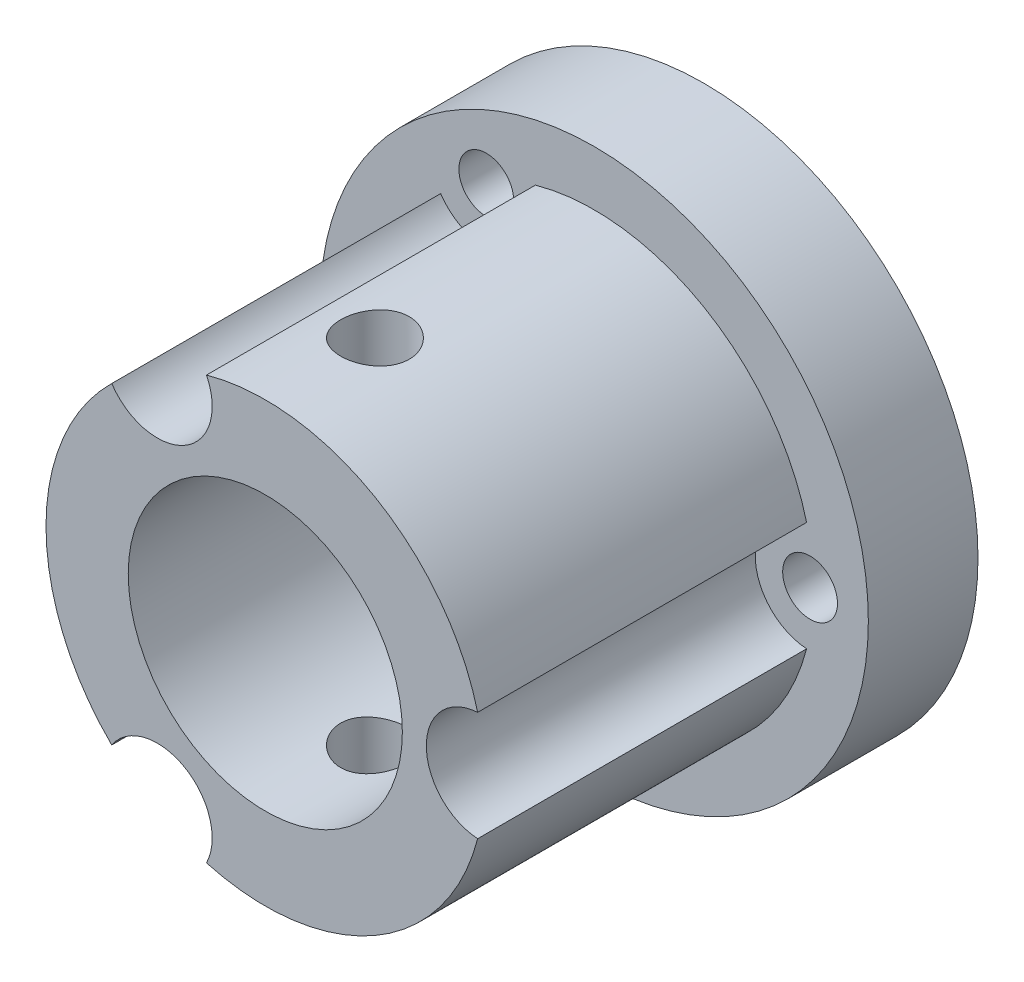
from build123d import *

# Parameters (mm, degrees)
SKETCH1_R                           = 15.875
SKETCH1_R_2                         = 7.9375
BOSS_EXTRUDE1_DEPTH                 = 6.35
SKETCH2_R                           = 14.29
SKETCH2_R_2                         = 7.9375
BOSS_EXTRUDE2_DEPTH                 = 19.05
SKETCH3_R                           = 1.5875
CUT_EXTRUDE1_DEPTH                  = 14.8
CUT_EXTRUDE3_DEPTH                  = 34.89972345
CUT_EXTRUDE3_DEPTH_BACK             = 34.89972345
SKETCH4_R                           = 1.9844
SKETCH5_R                           = 3.175
CUT_EXTRUDE4_DEPTH                  = 19.05
CUT_START                           = -19.05
CUT_CHANGE_FROM_065_WT_TO_125_DEPTH = 19.05


# Read off the part's stored shape, not the designer's step: Cut- Change from .065 WT to .125
with BuildPart() as part:
    # Sketch1 → Boss-Extrude1 (new body)
    with BuildSketch(Plane.XY):
        Circle(SKETCH1_R)
        Circle(SKETCH1_R_2, mode=Mode.SUBTRACT)
    extrude(amount=BOSS_EXTRUDE1_DEPTH)

    # Sketch2 → Boss-Extrude2 (add)
    with BuildSketch(Plane.XY.offset(6.35)):
        Circle(SKETCH2_R)
        Circle(SKETCH2_R_2, mode=Mode.SUBTRACT)
    extrude(amount=BOSS_EXTRUDE2_DEPTH)

    # Sketch3 → Cut-Extrude1 (cut)
    with BuildSketch(Plane(origin=(0, 0, 0), x_dir=(-1, 0, 0), z_dir=(0, 0, -1))):
        with Locations((6.25, 10.825317547)):
            Circle(SKETCH3_R)
        with Locations((6.25, -10.825317547)):
            Circle(SKETCH3_R)
        with Locations((-12.5, 0)):
            Circle(SKETCH3_R)
    extrude(amount=-CUT_EXTRUDE1_DEPTH, mode=Mode.SUBTRACT)

    # Sketch4 → Cut-Extrude3 (cut, two sides: drawn at the far end of the back side and taken through both)
    with BuildSketch(Plane(origin=(0, 0, 0), x_dir=(1, 0, 0), z_dir=(0, 1, 0)).offset(-CUT_EXTRUDE3_DEPTH_BACK)):
        with Locations(Location((0, -19.05, 0), (0, 0, 270))):
            Circle(SKETCH4_R)
    extrude(amount=CUT_EXTRUDE3_DEPTH + CUT_EXTRUDE3_DEPTH_BACK, mode=Mode.SUBTRACT)

    # Sketch5 → Cut-Extrude4 (cut)
    with BuildSketch(Plane.XY.offset(25.4)):
        with Locations((-6.25, 10.825317547)):
            Circle(SKETCH5_R)
        with Locations((12.5, 0)):
            Circle(SKETCH5_R)
        with Locations((-6.25, -10.825317547)):
            Circle(SKETCH5_R)
    extrude(amount=-CUT_EXTRUDE4_DEPTH, mode=Mode.SUBTRACT)

    # Cut- Change from .065 WT to .125 outline → Cut- Change from .065 WT to .125 (cut)
    with BuildSketch(Plane.XY.offset(25.4).offset(CUT_START)):
        with BuildLine():
            ThreePointArc((-8.893268269, -9.066409404), (-12.7, 0), (-8.893268269, 9.066409404))
            ThreePointArc((-8.893268269, 9.066409404), (-9.276867733, 9.866830861), (-9.423910813, 10.742160164))
            ThreePointArc((-9.423910813, 10.742160164), (-14.29, 0), (-9.423910813, -10.742160164))
            ThreePointArc((-9.423910813, -10.742160164), (-9.276867733, -9.866830861), (-8.893268269, -9.066409404))
        make_face()
        with BuildLine():
            ThreePointArc((-4.591028187, 13.532426249), (-3.906492314, 12.967418555), (-3.405106731, 12.235000946))
            ThreePointArc((-3.405106731, 12.235000946), (6.35, 10.998522628), (12.298375, 3.168591542))
            ThreePointArc((12.298375, 3.168591542), (13.183360047, 3.100587694), (14.014939, 2.790266085))
            ThreePointArc((14.014939, 2.790266085), (7.145, 12.37550302), (-4.591028187, 13.532426249))
        make_face()
        with BuildLine():
            ThreePointArc((12.298375, -3.168591542), (6.35, -10.998522628), (-3.405106731, -12.235000946))
            ThreePointArc((-3.405106731, -12.235000946), (-3.906492314, -12.967418555), (-4.591028187, -13.532426249))
            ThreePointArc((-4.591028187, -13.532426249), (7.145, -12.37550302), (14.014939, -2.790266085))
            ThreePointArc((14.014939, -2.790266085), (13.183360047, -3.100587694), (12.298375, -3.168591542))
        make_face()
    extrude(amount=CUT_CHANGE_FROM_065_WT_TO_125_DEPTH, mode=Mode.SUBTRACT)


solid = part.part
